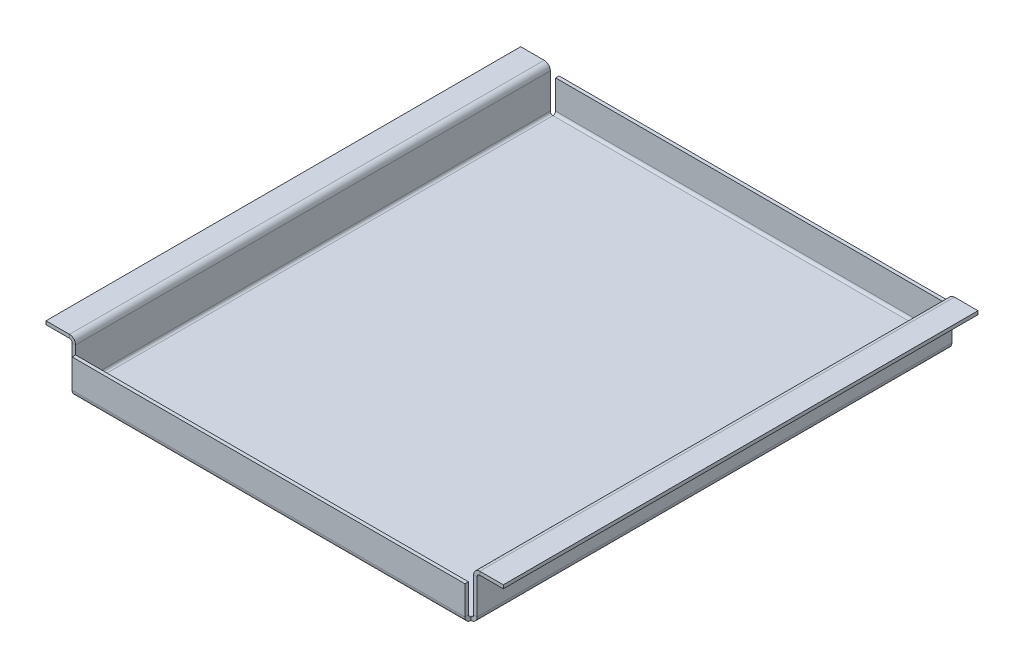
from build123d import *

# Parameters (mm, degrees)
BASE_FLANGIA1_DEPTH       = 272.5
BORDO_FLANGIA1_DEPTH      = 451
BORDO_FLANGIA1_BEND_DEPTH = 451


# Sheet-metal steps are written as plain solids
with BuildPart() as part:
    # Schizzo1 → Base-Flangia1 (new, symmetric)
    with BuildSketch(Plane.XY):
        with BuildLine():
            Line((-262.5, 50), (-235.5, 50))
            ThreePointArc((-235.5, 50), (-233.378679656, 49.121320344), (-232.5, 47))
            Line((-232.5, 47), (-232.5, 7))
            ThreePointArc((-232.5, 7), (-230.449747468, 2.050252532), (-225.5, 0))
            Line((-225.5, 0), (225.5, 0))
            ThreePointArc((225.5, 0), (230.449747468, 2.050252532), (232.5, 7))
            Line((232.5, 7), (232.5, 47))
            ThreePointArc((232.5, 47), (233.378679656, 49.121320344), (235.5, 50))
            Line((235.5, 50), (262.5, 50))
            Line((262.5, 50), (262.5, 54))
            Line((262.5, 54), (235.5, 54))
            ThreePointArc((235.5, 54), (230.550252532, 51.949747468), (228.5, 47))
            Line((228.5, 47), (228.5, 7))
            ThreePointArc((228.5, 7), (227.621320344, 4.878679656), (225.5, 4))
            Line((225.5, 4), (-225.5, 4))
            ThreePointArc((-225.5, 4), (-227.621320344, 4.878679656), (-228.5, 7))
            Line((-228.5, 7), (-228.5, 47))
            ThreePointArc((-228.5, 47), (-230.550252532, 51.949747468), (-235.5, 54))
            Line((-235.5, 54), (-262.5, 54))
            Line((-262.5, 54), (-262.5, 50))
        make_face()
    extrude(amount=BASE_FLANGIA1_DEPTH, both=True)

    # Bordo-Flangia1 section (across the edge) → Bordo-Flangia1 (add)
    with BuildSketch(Plane(origin=(-225.5, 4, 275.5), x_dir=(0, 0, -1), z_dir=(1, 0, 0))):
        with BuildLine():
            Line((-4, 3), (-4, 36))
            Line((-4, 36), (0, 36))
            Line((0, 36), (0, 3))
            ThreePointArc((0, 3), (0.878679656, 0.878679656), (3, 0))
            Line((3, 0), (3, -4))
            ThreePointArc((3, -4), (-1.949747468, -1.949747468), (-4, 3))
        make_face()
    extrude(amount=BORDO_FLANGIA1_DEPTH)

    # Bordo-Flangia1 section 2 (across the edge) → Bordo-Flangia1 bend (add)
    with BuildSketch(Plane(origin=(225.5, 4, -275.5), x_dir=(0, 0, 1), z_dir=(-1, 0, 0))):
        with BuildLine():
            Line((-4, 3), (-4, 36))
            Line((-4, 36), (0, 36))
            Line((0, 36), (0, 3))
            ThreePointArc((0, 3), (0.878679656, 0.878679656), (3, 0))
            Line((3, 0), (3, -4))
            ThreePointArc((3, -4), (-1.949747468, -1.949747468), (-4, 3))
        make_face()
    extrude(amount=BORDO_FLANGIA1_BEND_DEPTH)


solid = part.part
